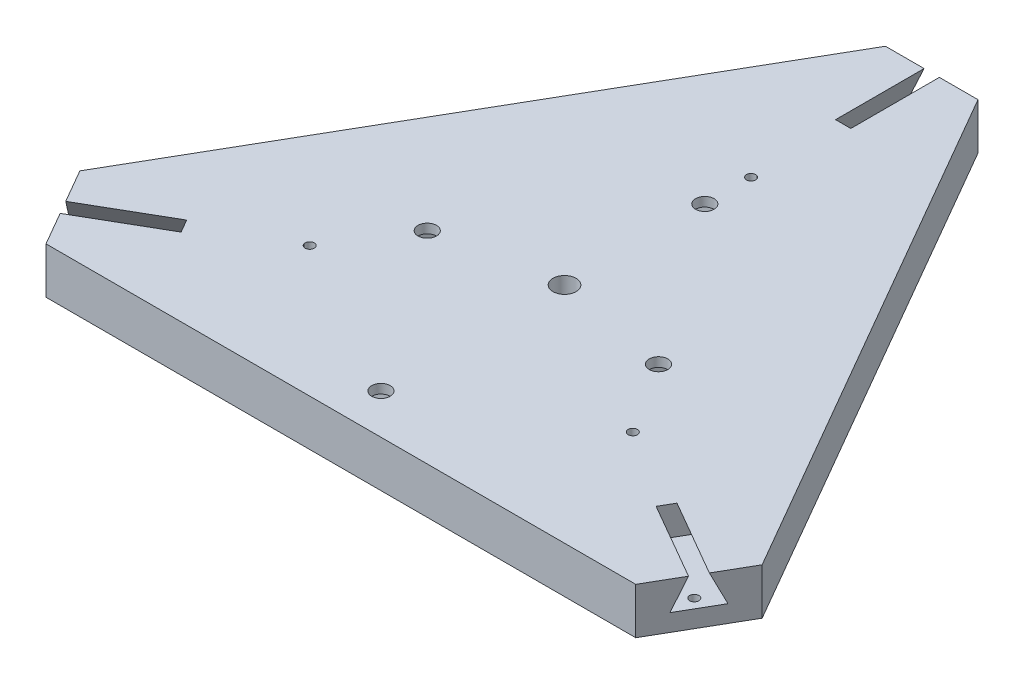
from build123d import *

# Parameters (mm, degrees)
ESQUISSE1_R                  = 2.5
BOSS_EXTRU_1_DEPTH           = 5
ESQUISSE2_R                  = 1
ENL_V_MAT_EXTRU_1_DEPTH      = 109.799753466
R_P_TITION_CIRCULAIRE1_COUNT = 3
ENL_V_MAT_EXTRU_2_DEPTH      = 19.14
R_P_TITION_CIRCULAIRE2_COUNT = 3
ESQUISSE4_R                  = 2
ENL_V_MAT_EXTRU_3_DEPTH      = 109.799753466
ESQUISSE5_W                  = 60.3
ESQUISSE5_H                  = 80.302539332
ESQUISSE5_W_2                = 39.7
ESQUISSE5_H_2                = 59.702539332
ENL_V_MAT_EXTRU_4_DEPTH      = 8
ESQUISSE6_R                  = 6.325
ESQUISSE6_R_2                = 3.325
BOSS_EXTRU_2_DEPTH           = 10


with BuildPart() as part:
    # Esquisse1 → Boss.-Extru.1 (new, symmetric)
    with BuildSketch(Plane(origin=(0, 0, 0), x_dir=(1, 0, 0), z_dir=(0, 1, 0))):
        Polygon((-10, 79.372539332), (10, 79.372539332), (73.738635424, -31.026015628), (63.738635424, -48.346523704), (-63.738635424, -48.346523704), (-73.738635424, -31.026015628), align=None)
        Circle(ESQUISSE1_R, mode=Mode.SUBTRACT)
    extrude(amount=BOSS_EXTRU_1_DEPTH, both=True)

    # Esquisse2 → Enlèv. mat.-Extru.1 (cut, through all)
    with BuildSketch(Plane(origin=(0, 5, 0), x_dir=(1, 0, 0), z_dir=(0, 1, 0))):
        with Locations((-66.357065564, -38.311269666)):
            Circle(ESQUISSE2_R)
        with Locations((-34.920343407, -20.161269666)):
            Circle(ESQUISSE2_R)
    enl_v_mat_extru_1 = extrude(amount=-ENL_V_MAT_EXTRU_1_DEPTH, mode=Mode.SUBTRACT)

    # Répétition circulaire1: Enlèv. mat.-Extru.1 ×3 about axis
    r_p_tition_circulaire1_axis = Axis((0, 5, 0), (0, -1, 0))
    for i in range(1, R_P_TITION_CIRCULAIRE1_COUNT):
        add(enl_v_mat_extru_1.rotate(r_p_tition_circulaire1_axis, i * 360 / R_P_TITION_CIRCULAIRE1_COUNT), mode=Mode.SUBTRACT)

    # Esquisse3 → Enlèv. mat.-Extru.2 (cut)
    with BuildSketch(Plane(origin=(68.738635424, 0, 39.686269666), x_dir=(0.5000000000000043, 0, -0.8660254037844363), z_dir=(0.8660254037844362, 0, 0.5000000000000042))):
        Polygon((1.65, 5), (4.59, -1.29), (-4.59, -1.29), (-1.65, 5), align=None)
    enl_v_mat_extru_2 = extrude(amount=-ENL_V_MAT_EXTRU_2_DEPTH, mode=Mode.SUBTRACT)

    # Répétition circulaire2: Enlèv. mat.-Extru.2 ×3 about axis
    r_p_tition_circulaire2_axis = Axis((0, 5, 0), (0, -1, 0))
    for i in range(1, R_P_TITION_CIRCULAIRE2_COUNT):
        add(enl_v_mat_extru_2.rotate(r_p_tition_circulaire2_axis, i * 360 / R_P_TITION_CIRCULAIRE2_COUNT), mode=Mode.SUBTRACT)

    # Esquisse4 → Enlèv. mat.-Extru.3 (cut, through all)
    with BuildSketch(Plane.XZ.offset(5)):
        with Locations((0, -30.322539332)):
            Circle(ESQUISSE4_R)
        with Locations((0, 39.68)):
            Circle(ESQUISSE4_R)
        with Locations((25, 4.68)):
            Circle(ESQUISSE4_R)
        with Locations((-25, 4.68)):
            Circle(ESQUISSE4_R)
    extrude(amount=-ENL_V_MAT_EXTRU_3_DEPTH, mode=Mode.SUBTRACT)

    # Esquisse5 → Enlèv. mat.-Extru.4 (cut)
    with BuildSketch(Plane.XZ.offset(5)):
        with Locations((0, 4.678730334)):
            Rectangle(ESQUISSE5_W, ESQUISSE5_H)
        with Locations((0, 4.678730334)):
            Rectangle(ESQUISSE5_W_2, ESQUISSE5_H_2, mode=Mode.SUBTRACT)
    extrude(amount=-ENL_V_MAT_EXTRU_4_DEPTH, mode=Mode.SUBTRACT)

    # Esquisse6 → Boss.-Extru.2 (add)
    with BuildSketch(Plane.XZ.offset(5)):
        with Locations((0, 20.18)):
            Circle(ESQUISSE6_R)
        with Locations((0, 20.18)):
            Circle(ESQUISSE6_R_2, mode=Mode.SUBTRACT)
    extrude(amount=BOSS_EXTRU_2_DEPTH)


solid = part.part
